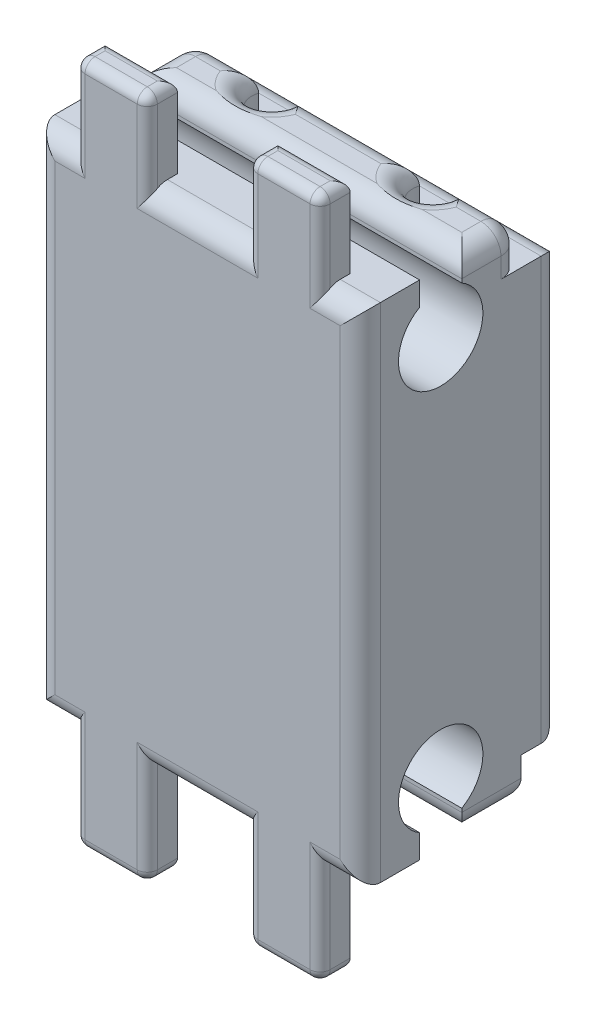
from build123d import *

# Parameters (mm, degrees)
SKETCH1_W                = 16.2
SKETCH1_H                = 25
BOSS_EXTRUDE1_DEPTH      = 10
SKETCH11_R               = 1
CUT_EXTRUDE9_DEPTH       = 25
SKETCH13_W               = 16.2
SKETCH13_H               = 2
CUT_EXTRUDE10_DEPTH      = 2
CUT_EXTRUDE16_DEPTH      = 14.1
CUT_EXTRUDE16_DEPTH_BACK = 14.1
FILLET1_R                = 1
BOSS_EXTRUDE2_DEPTH      = 5
BOSS_EXTRUDE2_DEPTH_BACK = 29
SKETCH15_W               = 3.6
SKETCH15_H               = 1.5
FILLET2_R                = 0.5


with BuildPart() as part:
    # Sketch1 → Boss-Extrude1 (new body)
    with BuildSketch(Plane.XY):
        with Locations((0, 12.5)):
            Rectangle(SKETCH1_W, SKETCH1_H)
    extrude(amount=BOSS_EXTRUDE1_DEPTH)

    # Sketch11 → Cut-Extrude9 (cut)
    with BuildSketch(Plane.XZ):
        with Locations((4, 2.295920755)):
            Circle(SKETCH11_R)
        with Locations((-4, 2.295920755)):
            Circle(SKETCH11_R)
    extrude(amount=-CUT_EXTRUDE9_DEPTH, mode=Mode.SUBTRACT)

    # Sketch13 → Cut-Extrude10 (cut)
    with BuildSketch(Plane(origin=(0, 0, 0), x_dir=(-1, 0, 0), z_dir=(0, 0, -1))):
        with Locations((0, 24)):
            Rectangle(SKETCH13_W, SKETCH13_H)
        with Locations((0, 1)):
            Rectangle(SKETCH13_W, SKETCH13_H)
    extrude(amount=-CUT_EXTRUDE10_DEPTH, mode=Mode.SUBTRACT)

    # Sketch14 → Cut-Extrude16 (cut, two sides: drawn at the far end of the back side and taken through both)
    with BuildSketch(Plane.ZY.offset(-CUT_EXTRUDE16_DEPTH_BACK)):
        with BuildLine():
            Line((4.95014734, 0), (7.04985266, 0))
            Line((7.04985266, 0), (7.04985266, 1.181261593))
            ThreePointArc((7.04985266, 1.181261593), (6, 5.1), (4.95014734, 1.181261593))
            Line((4.95014734, 1.181261593), (4.95014734, 0))
        make_face()
        with BuildLine():
            Line((4.95014734, 25), (7.04985266, 25))
            Line((7.04985266, 25), (7.04985266, 23.818738407))
            ThreePointArc((7.04985266, 23.818738407), (6, 19.9), (4.95014734, 23.818738407))
            Line((4.95014734, 23.818738407), (4.95014734, 25))
        make_face()
    extrude(amount=CUT_EXTRUDE16_DEPTH + CUT_EXTRUDE16_DEPTH_BACK, mode=Mode.SUBTRACT)

    # Fillet1
    # the kernel refuses this fillet: 1 mm, written as the material it takes off along each edge
    with BuildSketch(Plane(origin=(-7.1, 24, 3), x_dir=(-1, 0, 0), z_dir=(0, 1, 0))) as fillet1_piece_1_section:
        Polygon((0, 0), (FILLET1_R * 1.02, 0), (FILLET1_R * 1.02, -FILLET1_R * 1.02), (0, -FILLET1_R * 1.02), align=None)
    fillet1_piece_1 = extrude(amount=FILLET1_R * 1.02, mode=Mode.PRIVATE)
    fillet1_piece_1 = fillet1_piece_1 - Plane(origin=(-7.1, 24, 3), x_dir=(0.7071067811865475, 0, 0.7071067811865475), z_dir=(0, 1, 0)) * Sphere(FILLET1_R, mode=Mode.PRIVATE)
    add(fillet1_piece_1, mode=Mode.SUBTRACT)
    with BuildSketch(Plane(origin=(7.1, 24, 3), x_dir=(0, 1, 0), z_dir=(1, 0, 0))) as fillet1_piece_2_section:
        Polygon((0, 0), (FILLET1_R * 1.02, 0), (FILLET1_R * 1.02, -FILLET1_R * 1.02), (0, -FILLET1_R * 1.02), align=None)
    fillet1_piece_2 = extrude(amount=FILLET1_R * 1.02, mode=Mode.PRIVATE)
    fillet1_piece_2 = fillet1_piece_2 - Plane(origin=(7.1, 24, 3), x_dir=(0, -0.7071067811865475, 0.7071067811865475), z_dir=(1, 0, 0)) * Sphere(FILLET1_R, mode=Mode.PRIVATE)
    add(fillet1_piece_2, mode=Mode.SUBTRACT)
    with BuildSketch(Plane(origin=(8.1, 27.5, 10), x_dir=(0, 0, -1), z_dir=(0, -1, 0)), Plane(origin=(-8.1, -2.5, 10), x_dir=(0, 0, -1), z_dir=(0, 1, 0))) as fillet1_piece_3:
        with BuildLine():
            CenterArc((FILLET1_R, -FILLET1_R), FILLET1_R, 90, 90)
            Line((0, -FILLET1_R), (0, 0))
            Line((0, 0), (FILLET1_R, 0))
        make_face()
    extrude(amount=30, mode=Mode.SUBTRACT)
    with BuildSketch(Plane(origin=(-10.6, 25, 10), x_dir=(0, 0, -1), z_dir=(1, 0, 0)), Plane(origin=(-10.6, 2, 0), x_dir=(0, 0, 1), z_dir=(1, 0, 0)), Plane(origin=(10.6, 23, 0), x_dir=(0, 0, 1), z_dir=(-1, 0, 0)), Plane(origin=(10.6, 0, 4.95014734), x_dir=(0, 0, -1), z_dir=(-1, 0, 0))) as fillet1_piece_4:
        with BuildLine():
            CenterArc((FILLET1_R, -FILLET1_R), FILLET1_R, 90, 90)
            Line((0, -FILLET1_R), (0, 0))
            Line((0, 0), (FILLET1_R, 0))
        make_face()
    extrude(amount=21.2, mode=Mode.SUBTRACT)
    with BuildSketch(Plane(origin=(10.6, 0, 10), x_dir=(0, 1, 0), z_dir=(-1, 0, 0)), Plane(origin=(10.6, 25, 4.95014734), x_dir=(0, 0, -1), z_dir=(-1, 0, 0))) as fillet1_piece_5:
        with BuildLine():
            CenterArc((FILLET1_R, FILLET1_R), FILLET1_R, 180, 90)
            Line((0, FILLET1_R), (0, 0))
            Line((0, 0), (FILLET1_R, 0))
        make_face()
    extrude(amount=21.2, mode=Mode.SUBTRACT)
    with BuildSketch(Plane(origin=(-8.1, 23, 2), x_dir=(0, 0, 1), z_dir=(0, 1, 0)), Plane(origin=(8.1, 24, 2), x_dir=(0, 0, 1), z_dir=(0, -1, 0))) as fillet1_piece_6:
        with BuildLine():
            CenterArc((FILLET1_R, FILLET1_R), FILLET1_R, 180, 90)
            Line((0, FILLET1_R), (0, 0))
            Line((0, 0), (FILLET1_R, 0))
        make_face()
    extrude(amount=1, mode=Mode.SUBTRACT)
    with BuildSketch(Plane(origin=(-8.1, -0.5, 0), x_dir=(0, 0, 1), z_dir=(0, 1, 0)), Plane(origin=(8.1, 25.5, 0), x_dir=(0, 0, 1), z_dir=(0, -1, 0))) as fillet1_piece_7:
        with BuildLine():
            CenterArc((FILLET1_R, FILLET1_R), FILLET1_R, 180, 90)
            Line((0, FILLET1_R), (0, 0))
            Line((0, 0), (FILLET1_R, 0))
        make_face()
    extrude(amount=26, mode=Mode.SUBTRACT)
    with BuildSketch(Plane(origin=(10.6, 0, 2), x_dir=(0, 0, 1), z_dir=(-1, 0, 0)), Plane(origin=(-2.455212493, 0, 2), x_dir=(0, 0, 1), z_dir=(-1, 0, 0))) as fillet1_piece_8:
        with BuildLine():
            CenterArc((FILLET1_R, FILLET1_R), FILLET1_R, 180, 90)
            Line((0, FILLET1_R), (0, 0))
            Line((0, 0), (FILLET1_R, 0))
        make_face()
    extrude(amount=8.144787507, mode=Mode.SUBTRACT)
    with BuildSketch(Plane(origin=(4, 0, 2.295920755), x_dir=(1, 0, 0), z_dir=(0, 0, -1))) as fillet1_piece_9:
        with BuildLine():
            CenterArc((1 + FILLET1_R, -FILLET1_R), FILLET1_R, 90, 90)
            Line((1, -FILLET1_R), (1, 0))
            Line((1, 0), (1 + FILLET1_R, 0))
        make_face()
    revolve(axis=Axis((4, 0, 2.295920755), (0, -1, 0)), revolution_arc=340.728788086, mode=Mode.SUBTRACT)
    with BuildSketch(Plane(origin=(5.544787507, 0, 2), x_dir=(0, 0, 1), z_dir=(-1, 0, 0)), Plane(origin=(-5.544787507, 25, 2), x_dir=(0, 0, 1), z_dir=(1, 0, 0))) as fillet1_piece_10:
        with BuildLine():
            CenterArc((FILLET1_R, FILLET1_R), FILLET1_R, 180, 90)
            Line((0, FILLET1_R), (0, 0))
            Line((0, 0), (FILLET1_R, 0))
        make_face()
    extrude(amount=11.089575014, mode=Mode.SUBTRACT)
    with BuildSketch(Plane(origin=(-4, 0, 2.295920755), x_dir=(1, 0, 0), z_dir=(0, 0, -1))) as fillet1_piece_11:
        with BuildLine():
            CenterArc((1 + FILLET1_R, -FILLET1_R), FILLET1_R, 90, 90)
            Line((1, -FILLET1_R), (1, 0))
            Line((1, 0), (1 + FILLET1_R, 0))
        make_face()
    revolve(axis=Axis((-4, 0, 2.295920755), (0, -1, 0)), revolution_arc=340.728788086, mode=Mode.SUBTRACT)
    with BuildSketch(Plane(origin=(-8.1, 0, -0.5), x_dir=(1, 0, 0), z_dir=(0, 0, 1))) as fillet1_piece_12_section:
        with BuildLine():
            CenterArc((FILLET1_R, FILLET1_R), FILLET1_R, 180, 90)
            Line((0, FILLET1_R), (0, 0))
            Line((0, 0), (FILLET1_R, 0))
        make_face()
    fillet1_piece_12 = extrude(amount=7.95014734, mode=Mode.PRIVATE)
    fillet1_piece_12 = split(fillet1_piece_12, bisect_by=Plane(origin=(-7.876632061, 0.223367939, 7.04985266), z_dir=(0, 0, -1)), keep=Keep.TOP, mode=Mode.PRIVATE)
    add(fillet1_piece_12, mode=Mode.SUBTRACT)
    with BuildSketch(Plane(origin=(8.1, 0, -0.5), x_dir=(-1, 0, 0), z_dir=(0, 0, 1))) as fillet1_piece_13_section:
        with BuildLine():
            CenterArc((FILLET1_R, -FILLET1_R), FILLET1_R, 90, 90)
            Line((0, -FILLET1_R), (0, 0))
            Line((0, 0), (FILLET1_R, 0))
        make_face()
    fillet1_piece_13 = extrude(amount=7.95014734, mode=Mode.PRIVATE)
    fillet1_piece_13 = split(fillet1_piece_13, bisect_by=Plane(origin=(7.876632061, 0.223367939, 7.04985266), z_dir=(0, 0, -1)), keep=Keep.TOP, mode=Mode.PRIVATE)
    add(fillet1_piece_13, mode=Mode.SUBTRACT)
    with BuildSketch(Plane(origin=(-8.1, 25, 3), x_dir=(0, -1, 0), z_dir=(0, 0, 1))) as fillet1_piece_14_section:
        with BuildLine():
            CenterArc((FILLET1_R, FILLET1_R), FILLET1_R, 180, 90)
            Line((0, FILLET1_R), (0, 0))
            Line((0, 0), (FILLET1_R, 0))
        make_face()
    fillet1_piece_14 = extrude(amount=4.45014734, mode=Mode.PRIVATE)
    fillet1_piece_14 = split(fillet1_piece_14, bisect_by=Plane(origin=(-7.876632061, 24.776632061, 7.04985266), z_dir=(0, 0, -1)), keep=Keep.TOP, mode=Mode.PRIVATE)
    add(fillet1_piece_14, mode=Mode.SUBTRACT)
    with BuildSketch(Plane(origin=(-7.1, 25, 2), x_dir=(0, 0, 1), z_dir=(1, 0, 0)), Plane(origin=(2.455212493, 25, 2), x_dir=(0, 0, 1), z_dir=(1, 0, 0))) as fillet1_piece_15:
        with BuildLine():
            CenterArc((FILLET1_R, FILLET1_R), FILLET1_R, 180, 90)
            Line((0, FILLET1_R), (0, 0))
            Line((0, 0), (FILLET1_R, 0))
        make_face()
    extrude(amount=4.644787507, mode=Mode.SUBTRACT)
    with BuildSketch(Plane(origin=(-4, 25, 2.295920755), x_dir=(1, 0, 0), z_dir=(0, 0, -1))) as fillet1_piece_16:
        with BuildLine():
            CenterArc((1 + FILLET1_R, FILLET1_R), FILLET1_R, 180, 90)
            Line((1 + FILLET1_R, 0), (1, 0))
            Line((1, 0), (1, FILLET1_R))
        make_face()
    revolve(axis=Axis((-4, 25, 2.295920755), (0, -1, 0)), revolution_arc=340.728788086, mode=Mode.SUBTRACT)
    with BuildSketch(Plane(origin=(4, 25, 2.295920755), x_dir=(1, 0, 0), z_dir=(0, 0, -1))) as fillet1_piece_17:
        with BuildLine():
            CenterArc((1 + FILLET1_R, FILLET1_R), FILLET1_R, 180, 90)
            Line((1 + FILLET1_R, 0), (1, 0))
            Line((1, 0), (1, FILLET1_R))
        make_face()
    revolve(axis=Axis((4, 25, 2.295920755), (0, -1, 0)), revolution_arc=340.728788086, mode=Mode.SUBTRACT)
    with BuildSketch(Plane(origin=(8.1, 25, 3), x_dir=(0, -1, 0), z_dir=(0, 0, 1))) as fillet1_piece_18_section:
        with BuildLine():
            CenterArc((FILLET1_R, -FILLET1_R), FILLET1_R, 90, 90)
            Line((0, -FILLET1_R), (0, 0))
            Line((0, 0), (FILLET1_R, 0))
        make_face()
    fillet1_piece_18 = extrude(amount=4.45014734, mode=Mode.PRIVATE)
    fillet1_piece_18 = split(fillet1_piece_18, bisect_by=Plane(origin=(7.876632061, 24.776632061, 7.04985266), z_dir=(0, 0, -1)), keep=Keep.TOP, mode=Mode.PRIVATE)
    add(fillet1_piece_18, mode=Mode.SUBTRACT)
    with BuildSketch(Plane(origin=(4, 25, 2.295920755), x_dir=(-0.9423750058314979, 0, -0.3345584379209173), z_dir=(-0.3345584379209173, 0, 0.9423750058314979))) as fillet1_piece_19:
        with BuildLine():
            CenterArc((1 + FILLET1_R, FILLET1_R), FILLET1_R, 180, 90)
            Line((1 + FILLET1_R, 0), (1, 0))
            Line((1, 0), (1, FILLET1_R))
        make_face()
    revolve(axis=Axis((4, 25, 2.295920755), (0, -1, 0)), revolution_arc=160.454310973, mode=Mode.SUBTRACT)
    with BuildSketch(Plane(origin=(-4, 25, 2.295920755), x_dir=(-0.9423750058314977, 0, -0.3345584379209177), z_dir=(-0.3345584379209177, 0, 0.9423750058314977))) as fillet1_piece_20:
        with BuildLine():
            CenterArc((1 + FILLET1_R, FILLET1_R), FILLET1_R, 180, 90)
            Line((1 + FILLET1_R, 0), (1, 0))
            Line((1, 0), (1, FILLET1_R))
        make_face()
    revolve(axis=Axis((-4, 25, 2.295920755), (0, -1, 0)), revolution_arc=160.454310973, mode=Mode.SUBTRACT)
    with BuildSketch(Plane(origin=(-4, 0, 2.295920755), x_dir=(-0.9423750058314979, 0, -0.3345584379209174), z_dir=(-0.3345584379209174, 0, 0.9423750058314979))) as fillet1_piece_21:
        with BuildLine():
            CenterArc((1 + FILLET1_R, -FILLET1_R), FILLET1_R, 90, 90)
            Line((1, -FILLET1_R), (1, 0))
            Line((1, 0), (1 + FILLET1_R, 0))
        make_face()
    revolve(axis=Axis((-4, 0, 2.295920755), (0, -1, 0)), revolution_arc=160.454310973, mode=Mode.SUBTRACT)
    with BuildSketch(Plane(origin=(4, 0, 2.295920755), x_dir=(-0.9423750058314975, 0, -0.3345584379209186), z_dir=(-0.3345584379209186, 0, 0.9423750058314975))) as fillet1_piece_22:
        with BuildLine():
            CenterArc((1 + FILLET1_R, -FILLET1_R), FILLET1_R, 90, 90)
            Line((1, -FILLET1_R), (1, 0))
            Line((1, 0), (1 + FILLET1_R, 0))
        make_face()
    revolve(axis=Axis((4, 0, 2.295920755), (0, -1, 0)), revolution_arc=160.454310973, mode=Mode.SUBTRACT)

    # Sketch15 → Boss-Extrude2 (add, two sides: drawn at the far end of the back side and taken through both)
    with BuildSketch(Plane.XZ.offset(-BOSS_EXTRUDE2_DEPTH_BACK)):
        with Locations((-4.3, 9.25)):
            Rectangle(SKETCH15_W, SKETCH15_H)
        with Locations((4.3, 9.25)):
            Rectangle(SKETCH15_W, SKETCH15_H)
    extrude(amount=BOSS_EXTRUDE2_DEPTH + BOSS_EXTRUDE2_DEPTH_BACK)

    # Fillet2
    fillet2_edges = [part.edges().sort_by_distance(p)[0] for p in [
        (-4.3, 29, 8.5),
        (-6.1, 29, 9.25),
        (-6.1, -2, 10),
        (-2.5, -2, 10),
        (-2.5, 29, 9.25),
        (-2.5, 26.5, 10),
        (-6.1, 26.5, 10),
        (-4.3, 29, 10),
        (-6.1, -5, 9.25),
        (-4.3, -5, 8.5),
        (-2.5, -5, 9.25),
        (-4.3, -5, 10),
        (4.3, 29, 8.5),
        (2.5, 29, 9.25),
        (2.5, -2, 10),
        (6.1, -2, 10),
        (6.1, 29, 9.25),
        (6.1, 26.5, 10),
        (2.5, 26.5, 10),
        (4.3, 29, 10),
        (2.5, -5, 9.25),
        (4.3, -5, 8.5),
        (6.1, -5, 9.25),
        (4.3, -5, 10),
    ]]
    fillet(fillet2_edges, radius=FILLET2_R)


solid = part.part
